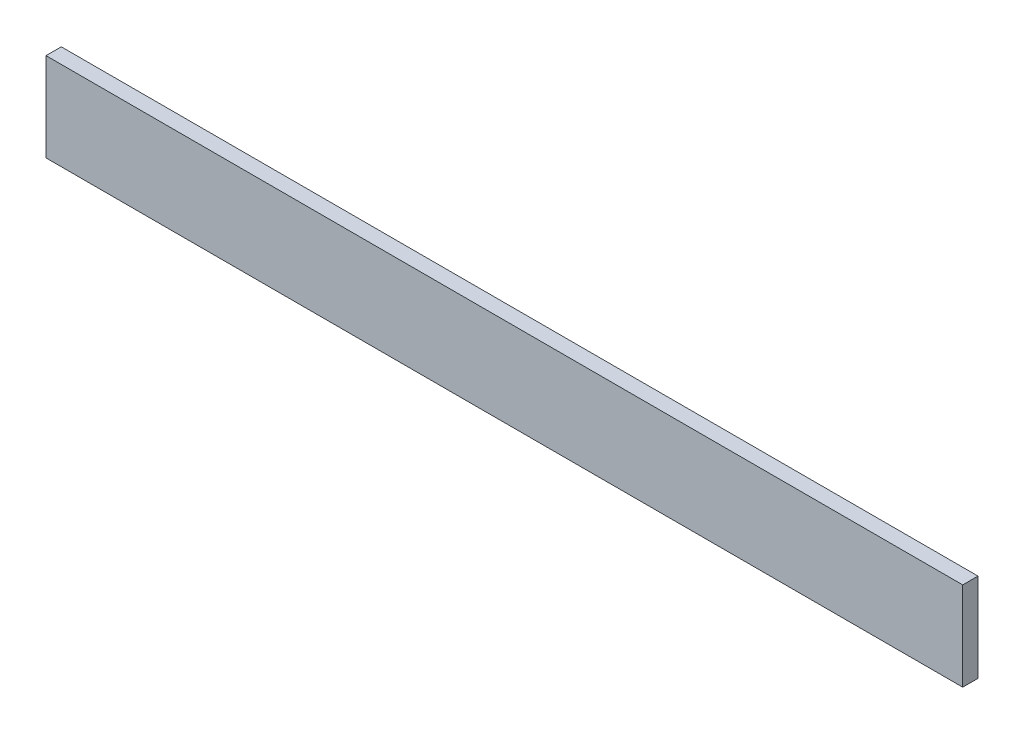
from build123d import *

# Parameters (mm, degrees)
ESQUISSE1_W        = 600
ESQUISSE1_H        = 58
BOSS_EXTRU_1_DEPTH = 10


with BuildPart() as part:
    # Esquisse1 → Boss.-Extru.1 (new body)
    with BuildSketch(Plane.XY):
        with Locations((300, 29)):
            Rectangle(ESQUISSE1_W, ESQUISSE1_H)
    extrude(amount=BOSS_EXTRU_1_DEPTH)


solid = part.part
